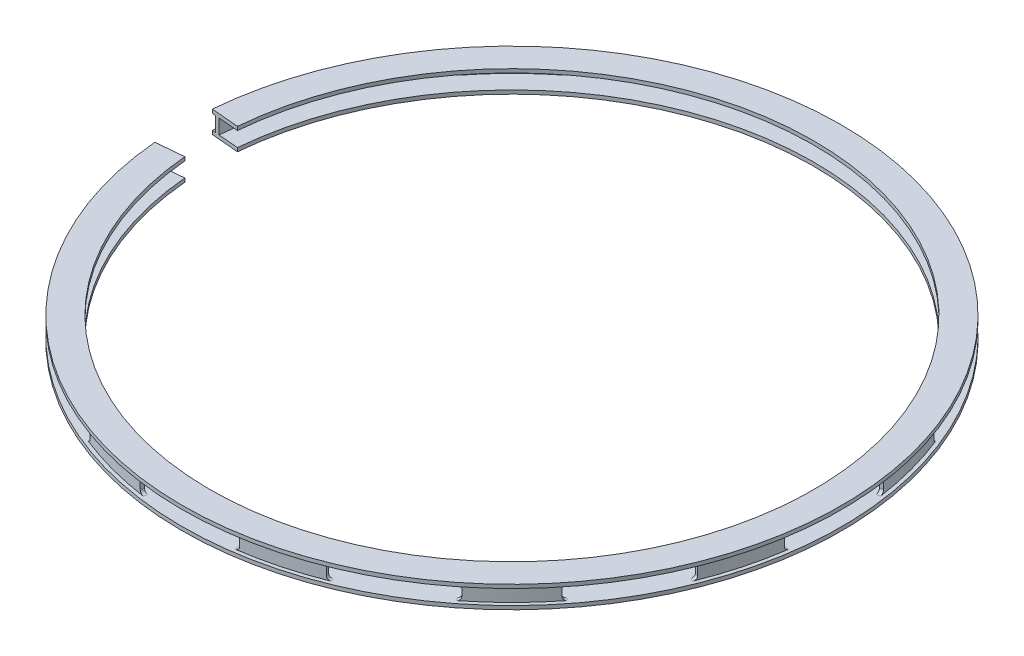
from build123d import *
from build123d.topology import SkipClean

# Parameters (mm, degrees)
REVOLVE1_ANGLE           = 350
SKETCH2_W                = 1
SKETCH2_H                = 2
CUT_REVOLVE3_ANGLE       = 17.5
FILLET1_R                = 0.5
CIRPATTERN4_COUNT        = 12
FILLET1_OF_CIRPATTERN4_R = 0.5


with BuildPart() as part:
    # Sketch1 → Revolve1 (revolve, symmetric)
    with SkipClean():  # the faces are left unmerged after this step: merging them gives an invalid solid
        with BuildSketch(Plane.XY) as revolve1_sk:
            Polygon((41, 0), (44.75, 0), (44.75, 0.5), (44.25, 0.5), (44.25, 2.5), (44.75, 2.5), (44.75, 3), (41, 3), (41, 2.5), (43.75, 2.5), (43.75, 0.5), (41, 0.5), align=None)
        revolve(axis=Axis((0, 0, 0), (0, 1, 0)), revolution_arc=REVOLVE1_ANGLE / 2)
        revolve(revolve1_sk.sketch, axis=Axis((0, 0, 0), (0, -1, 0)), revolution_arc=REVOLVE1_ANGLE / 2)
    add(part.part.scale(1), mode=Mode.REPLACE)  # the faces are merged on a copy

    # Sketch2 → Cut-Revolve3 (revolve, symmetric, cut)
    with BuildSketch(Plane.XY) as cut_revolve3_sk:
        with Locations((43.75, 1.5)):
            Rectangle(SKETCH2_W, SKETCH2_H)
    cut_revolve3 = revolve(axis=Axis((0, 0, 0), (0, 1, 0)), revolution_arc=CUT_REVOLVE3_ANGLE / 2, mode=Mode.SUBTRACT)
    cut_revolve3 = cut_revolve3 + revolve(cut_revolve3_sk.sketch, axis=Axis((0, 0, 0), (0, -1, 0)), revolution_arc=CUT_REVOLVE3_ANGLE / 2, mode=Mode.SUBTRACT)

    # Fillet1
    fillet1_edges = [part.edges().sort_by_distance(p)[0] for p in [
        (43.487906461, 2.5, 6.693428992),
        (43.487906461, 0.5, 6.693428992),
        (43.487906461, 0.5, -6.693428992),
        (43.487906461, 2.5, -6.693428992),
    ]]
    fillet(fillet1_edges, radius=FILLET1_R)

    # CirPattern4: Cut-Revolve3 ×12 about axis, 1 skipped
    cirpattern4_axis = Axis((0, 3, 0), (0, -1, 0))
    add([cut_revolve3.rotate(cirpattern4_axis, i * 360 / CIRPATTERN4_COUNT) for i in range(1, CIRPATTERN4_COUNT) if i not in (6,)], mode=Mode.SUBTRACT)

    # Fillet1 of CirPattern4
    fillet1_of_cirpattern4_edges = [part.edges().sort_by_distance(p)[0] for p in [
        (34.314917256, 2.5, 27.540632776),
        (34.314917256, 0.5, 27.540632776),
        (41.008346248, 0.5, 15.947273684),
        (41.008346248, 2.5, 15.947273684),
        (15.947273684, 2.5, 41.008346248),
        (15.947273684, 0.5, 41.008346248),
        (27.540632776, 0.5, 34.314917256),
        (27.540632776, 2.5, 34.314917256),
        (-6.693428992, 2.5, 43.487906461),
        (-6.693428992, 0.5, 43.487906461),
        (6.693428992, 0.5, 43.487906461),
        (6.693428992, 2.5, 43.487906461),
        (-27.540632776, 2.5, 34.314917256),
        (-27.540632776, 0.5, 34.314917256),
        (-15.947273684, 0.5, 41.008346248),
        (-15.947273684, 2.5, 41.008346248),
        (-41.008346248, 2.5, 15.947273684),
        (-41.008346248, 0.5, 15.947273684),
        (-34.314917256, 0.5, 27.540632776),
        (-34.314917256, 2.5, 27.540632776),
        (-34.314917256, 2.5, -27.540632776),
        (-34.314917256, 0.5, -27.540632776),
        (-41.008346248, 0.5, -15.947273684),
        (-41.008346248, 2.5, -15.947273684),
        (-15.947273684, 2.5, -41.008346248),
        (-15.947273684, 0.5, -41.008346248),
        (-27.540632776, 0.5, -34.314917256),
        (-27.540632776, 2.5, -34.314917256),
        (6.693428992, 2.5, -43.487906461),
        (6.693428992, 0.5, -43.487906461),
        (-6.693428992, 0.5, -43.487906461),
        (-6.693428992, 2.5, -43.487906461),
        (27.540632776, 2.5, -34.314917256),
        (27.540632776, 0.5, -34.314917256),
        (15.947273684, 0.5, -41.008346248),
        (15.947273684, 2.5, -41.008346248),
        (41.008346248, 2.5, -15.947273684),
        (41.008346248, 0.5, -15.947273684),
        (34.314917256, 0.5, -27.540632776),
        (34.314917256, 2.5, -27.540632776),
    ]]
    fillet(fillet1_of_cirpattern4_edges, radius=FILLET1_OF_CIRPATTERN4_R)


solid = part.part
